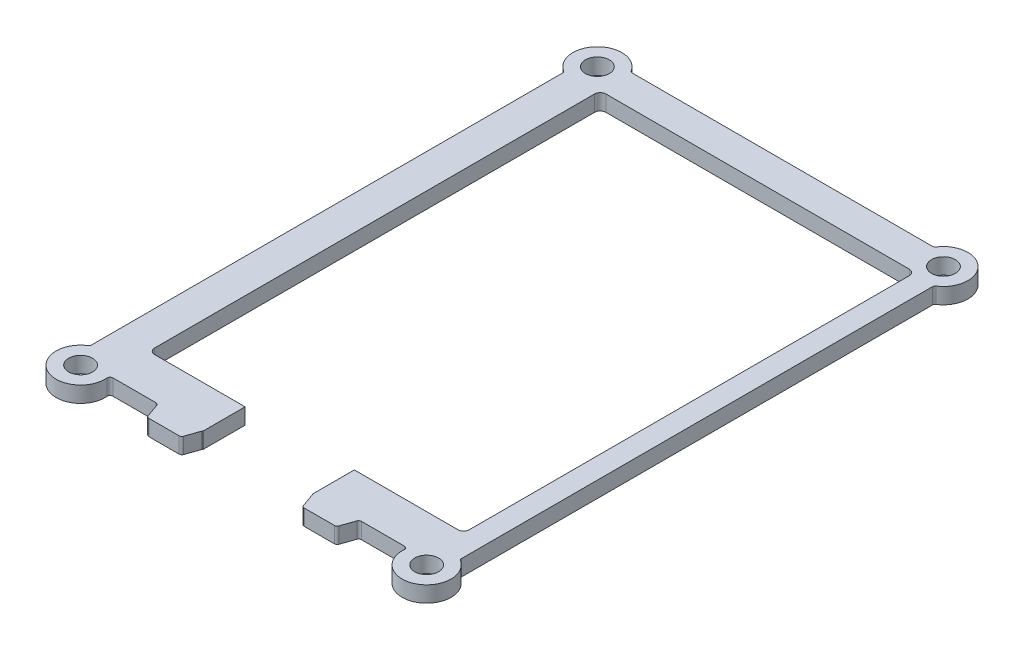
from build123d import *

# Parameters (mm, degrees)
BASEPLATE_OUTLINE_R = 2.1
BASEPLATE_DEPTH     = 2.8
CUT_EXTRUDE1_REACH  = 115.438
FILLET1_R           = 1


# Read off the part's stored shape, not the designer's step: BasePlate
with BuildPart() as part:
    # BasePlate outline → BasePlate (new body)
    with BuildSketch(Plane(origin=(0, 0, 0), x_dir=(1, 0, 0), z_dir=(0, 1, 0))):
        with BuildLine():
            Line((43.502626614, -5.852332608), (48.792614178, -5.852332608))
            ThreePointArc((48.792614178, -5.852332608), (49.082078508, -5.760021707), (49.264659986, -5.517174213))
            Line((49.264659986, -5.517174213), (50.078201202, -3.187491002))
            ThreePointArc((50.078201202, -3.187491002), (50.26078268, -2.944643509), (50.55024701, -2.852332608))
            Line((50.55024701, -2.852332608), (58.116695703, -2.852332608))
            ThreePointArc((58.116695703, -2.852332608), (58.484685739, -3.013831008), (58.614956567, -3.393999275))
            ThreePointArc((58.614956567, -3.393999275), (64.799237397, -7.61016844), (65.229166667, -0.137781095))
            ThreePointArc((65.229166667, -0.137781095), (65.061014427, 0.043158816), (65, 0.282515593))
            Line((65, 0.282515593), (65, 83.012819192))
            ThreePointArc((65, 83.012819192), (65.061014427, 83.252175969), (65.229166667, 83.433115879))
            ThreePointArc((65.229166667, 83.433115879), (65.940559159, 90.088226551), (59.285448487, 89.376834059))
            ThreePointArc((59.285448487, 89.376834059), (59.104508577, 89.208681819), (58.8651518, 89.147667392))
            Line((58.8651518, 89.147667392), (6.1348482, 89.147667392))
            ThreePointArc((6.1348482, 89.147667392), (5.895491423, 89.208681819), (5.714551513, 89.376834059))
            ThreePointArc((5.714551513, 89.376834059), (-0.940559159, 90.088226551), (-0.229166667, 83.433115879))
            ThreePointArc((-0.229166667, 83.433115879), (-0.061014427, 83.252175969), (0, 83.012819192))
            Line((0, 83.012819192), (0, 0.282515593))
            ThreePointArc((0, 0.282515593), (-0.061014427, 0.043158816), (-0.229166667, -0.137781095))
            ThreePointArc((-0.229166667, -0.137781095), (0.200762603, -7.61016844), (6.385043433, -3.393999275))
            ThreePointArc((6.385043433, -3.393999275), (6.515314261, -3.013831008), (6.883304297, -2.852332608))
            Line((6.883304297, -2.852332608), (14.44975299, -2.852332608))
            ThreePointArc((14.44975299, -2.852332608), (14.73921732, -2.944643509), (14.921798798, -3.187491002))
            Line((14.921798798, -3.187491002), (15.735340014, -5.517174213))
            ThreePointArc((15.735340014, -5.517174213), (15.917921492, -5.760021707), (16.207385822, -5.852332608))
            Line((16.207385822, -5.852332608), (21.497373386, -5.852332608))
            ThreePointArc((21.497373386, -5.852332608), (21.786837716, -5.760021707), (21.969419194, -5.517174213))
            Line((21.969419194, -5.517174213), (22.78296041, -3.187491002))
            ThreePointArc((22.78296041, -3.187491002), (22.965541888, -2.944643509), (23.255006218, -2.852332608))
            Line((23.255006218, -2.852332608), (41.744993782, -2.852332608))
            ThreePointArc((41.744993782, -2.852332608), (42.034458112, -2.944643509), (42.21703959, -3.187491002))
            Line((42.21703959, -3.187491002), (43.030580806, -5.517174213))
            ThreePointArc((43.030580806, -5.517174213), (43.213162284, -5.760021707), (43.502626614, -5.852332608))
        make_face()
        with Locations((2.1, -3.752332608)):
            Circle(BASEPLATE_OUTLINE_R, mode=Mode.SUBTRACT)
        with Locations((62.9, -3.752332608)):
            Circle(BASEPLATE_OUTLINE_R, mode=Mode.SUBTRACT)
        with Locations((2.1, 87.047667392)):
            Circle(BASEPLATE_OUTLINE_R, mode=Mode.SUBTRACT)
        with Locations((62.9, 87.047667392)):
            Circle(BASEPLATE_OUTLINE_R, mode=Mode.SUBTRACT)
    extrude(amount=BASEPLATE_DEPTH)

    # Sketch3 → Cut-Extrude1 (cut, up to next)
    with BuildSketch(Plane(origin=(0, 2.8, 0), x_dir=(1, 0, 0), z_dir=(0, 1, 0)), mode=Mode.PRIVATE) as cut_extrude1_sk1:
        Polygon((6, 83.647667392), (6, 4.347667392), (22.9, 4.347667392), (22.9, -3.00023804), (42.1, -3.00023804), (42.1, 4.347667392), (61.3, 4.347667392), (61.3, 83.647667392), align=None)
    cut_extrude1_tool1 = extrude(cut_extrude1_sk1.sketch, amount=-CUT_EXTRUDE1_REACH, mode=Mode.PRIVATE) & part.part
    add(cut_extrude1_tool1.solids().sort_by_distance((33.614156, 2.8, -42.647328))[0], mode=Mode.SUBTRACT)

    # Fillet1
    fillet1_edges = [part.edges().sort_by_distance(p)[0] for p in [
        (6, 1.4, -83.647667392),
        (61.3, 1.4, -83.647667392),
        (61.3, 1.4, -4.347667392),
        (6, 1.4, -4.347667392),
    ]]
    fillet(fillet1_edges, radius=FILLET1_R)


solid = part.part
